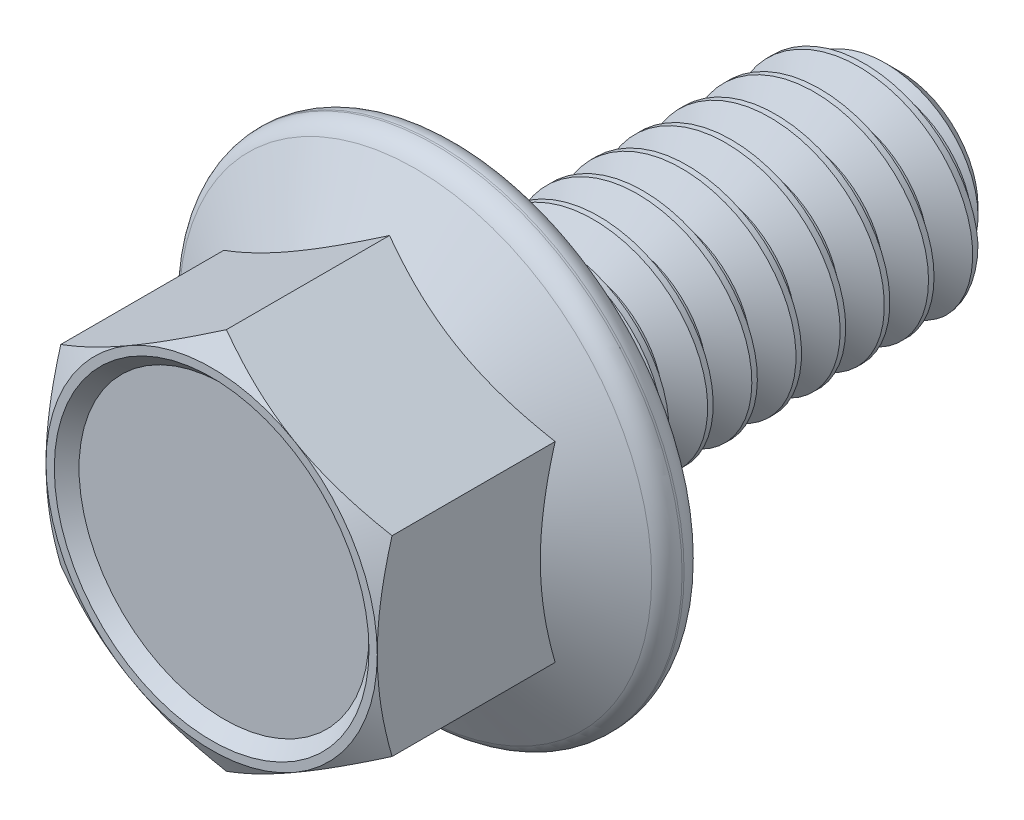
from build123d import *

# Parameters (mm, degrees)
BOSS_EXTRUDE1_REACH = 24.219
SKETCH4_OUTSIDE_W   = 102.304
SKETCH4_OUTSIDE_H   = 102.304
SKETCH4_OUTSIDE_R   = 4.7625
CUT_EXTRUDE1_DEPTH  = 23.218830572
CUT_EXTRUDE1_DRAFT  = -60
SKETCH10_R          = 4.524375
CUT_EXTRUDE2_DEPTH  = 0.3556
CUT_EXTRUDE2_DRAFT  = -45
FILLET1_R           = 0.64008
CUT_SWEEP1_PITCH    = 1.27
CUT_SWEEP1_TO       = 12.7
SKETCH8_R           = 3.175
BOSS_EXTRUDE2_DEPTH = 4.445
BOSS_EXTRUDE2_TAPER = 20


with BuildPart() as part:
    # Sketch2 → Revolve1 (revolve)
    with BuildSketch(Plane(origin=(0, 0, 0), x_dir=(0, 0, -1), z_dir=(1, 0, 0)), mode=Mode.PRIVATE) as revolve1_sk:
        Polygon((-9.906, 0), (9.906, 0), (9.906, 2.2225), (8.9535, 3.175), (-2.794, 3.175), (-2.794, 7.112), (-3.8608, 7.112), (-5.217284457, 4.7625), (-9.906, 4.7625), align=None)
    revolve(revolve1_sk.sketch.rotate(Axis((0, 0, 9.906), (0, 0, -1)), 90), axis=Axis((0, 0, 9.906), (0, 0, -1)))

    # Boss-Extrude1: up to this cone (the profile starts outside it)
    boss_extrude1_end = Plane(origin=(0, 0, 9.906), z_dir=(0, 0, -1)).offset(1.939085886) * Cone(1.732e-06, 39.45597037, 22.779914114, align=(Align.CENTER, Align.CENTER, Align.MIN), mode=Mode.PRIVATE)
    # Sketch3 → Boss-Extrude1 (add, up to the surface)
    with BuildSketch(Plane.XY.offset(9.906), mode=Mode.PRIVATE) as boss_extrude1_sk1:
        Polygon((0, 5.499261314), (-4.7625, 2.749630657), (-4.7625, -2.749630657), (0, -5.499261314), (4.7625, -2.749630657), (4.7625, 2.749630657), align=None)
    boss_extrude1_tool1 = extrude(boss_extrude1_sk1.sketch, amount=-BOSS_EXTRUDE1_REACH, mode=Mode.PRIVATE) - boss_extrude1_end
    add(boss_extrude1_tool1.solids().sort_by_distance((0, 0, 9.906))[0])


with BuildPart() as cut_extrude1_tool:
    # Sketch4 outside → Cut-Extrude1 (with draft: the straight prism first)
    with BuildSketch(Plane.XY.offset(9.906)):
        Rectangle(SKETCH4_OUTSIDE_W, SKETCH4_OUTSIDE_H)
        Circle(SKETCH4_OUTSIDE_R, mode=Mode.SUBTRACT)
    extrude(amount=-CUT_EXTRUDE1_DEPTH)
    # Cut-Extrude1: the draft: its side faces are tilted about the plane it starts from
    cut_extrude1_sides = [cut_extrude1_tool.faces().sort_by_distance(p)[0] for p in [
        (0, -51.152, -1.703415286),
        (51.152, 0, -1.703415286),
        (0, 51.152, -1.703415286),
        (-51.152, 0, -1.703415286),
        (-4.7625, 0, -1.703415286),
    ]]
    draft(cut_extrude1_sides, Plane.XY.offset(9.906), CUT_EXTRUDE1_DRAFT)


with BuildPart() as part_1:
    add(part.part)

    # Cut-Extrude1: cut by cut_extrude1_tool
    add(cut_extrude1_tool.part, mode=Mode.SUBTRACT)


with BuildPart() as cut_extrude2_tool:
    # Sketch10 → Cut-Extrude2 (with draft: the straight prism first)
    with BuildSketch(Plane.XY.offset(9.906)):
        Circle(SKETCH10_R)
    extrude(amount=-CUT_EXTRUDE2_DEPTH)
    # Cut-Extrude2: the draft: its side faces are tilted about the plane it starts from
    cut_extrude2_sides = [cut_extrude2_tool.faces().sort_by_distance(p)[0] for p in [
        (-4.524375, 0, 9.7282),
    ]]
    draft(cut_extrude2_sides, Plane.XY.offset(9.906), CUT_EXTRUDE2_DRAFT)


with BuildPart() as part_2:
    add(part_1.part)

    # Cut-Extrude2: cut by cut_extrude2_tool
    add(cut_extrude2_tool.part, mode=Mode.SUBTRACT)

    # Fillet1
    fillet1_edges = [part_2.edges().sort_by_distance(p)[0] for p in [
        (-7.112, 0, 3.8608),
        (-7.112, 0, 2.794),
    ]]
    fillet(fillet1_edges, radius=FILLET1_R)


with BuildPart() as body_2:
    # Split1: read off the stored shape, not the designer's step
    # Split1: the piece on the far side of the plane
    add(part_2.part)
    split(bisect_by=Plane.XY.offset(2.794), keep=Keep.BOTTOM)

    # Cut-Sweep1: arcs per turn and ends read off the stored shape
    # Cut-Sweep1: the profile of Sketch7 screwed along a right-hand helix through 13 turns, 8 arcs to a turn; built about Z, then put on its axis
    cut_sweep1_z = Axis((0, 0, 0), (0, 0, 1))
    cut_sweep1_corners = [(3.243740766, 0, 0.0396875), (2.350110803, 0, -0.47625), (2.350110803, 0, -0.635), (3.243740766, 0, -1.1509375)]
    with BuildLine(mode=Mode.PRIVATE) as cut_sweep1_profile:
        Line(cut_sweep1_corners[0], cut_sweep1_corners[1])
        Line(cut_sweep1_corners[1], cut_sweep1_corners[2])
        Line(cut_sweep1_corners[2], cut_sweep1_corners[3])
        Line(cut_sweep1_corners[3], cut_sweep1_corners[0])
    cut_sweep1_cap = Face(cut_sweep1_profile.wire())
    cut_sweep1_turn_angles = [0, 22.5, 45, 67.5, 90, 112.5, 135, 157.5, 180, 202.5, 225, 247.5, 270, 292.5, 315, 337.5, 360]
    cut_sweep1_turn_weights = [1, 0.9238795325112867, 1, 0.9238795325112867, 1, 0.9238795325112867, 1, 0.9238795325112867, 1, 0.9238795325112867, 1, 0.9238795325112867, 1, 0.9238795325112867, 1, 0.9238795325112867, 1]
    cut_sweep1_turn_rails = [Edge.make_bspline([Vector(p[0], p[1], 0).rotate(cut_sweep1_z, cut_sweep1_turn_angles[k]) / cut_sweep1_turn_weights[k] + Vector(0, 0, p[2] + CUT_SWEEP1_PITCH * cut_sweep1_turn_angles[k] / 360) for k in range(17)], [0, 0, 0, 1, 1, 2, 2, 3, 3, 4, 4, 5, 5, 6, 6, 7, 7, 8, 8, 8], 2, cut_sweep1_turn_weights) for p in cut_sweep1_corners]
    cut_sweep1_turn_sides = [Face.make_surface_from_curves(cut_sweep1_turn_rails[p[0]], cut_sweep1_turn_rails[p[1]]) for p in [(0, 1), (1, 2), (2, 3), (3, 0)]]
    cut_sweep1 = Plane(origin=(0, 0, -9.906), x_dir=(0, 1, 0), z_dir=(0, 0, 1)) * split(Solid(Shell([*[p.moved(Location((0, 0, CUT_SWEEP1_PITCH * i))) for i in range(13) for p in cut_sweep1_turn_sides], cut_sweep1_cap, cut_sweep1_cap.rotate(cut_sweep1_z, 4680).moved(Location((0, 0, CUT_SWEEP1_PITCH * 4680 / 360)))])), bisect_by=Plane.XY.offset(CUT_SWEEP1_TO), keep=Keep.BOTTOM, mode=Mode.PRIVATE)
    add(cut_sweep1, mode=Mode.SUBTRACT)


with BuildPart() as part_3:
    add(part_2.part)

    # Split1
    split(bisect_by=Plane.XY.offset(2.794), keep=Keep.TOP)


with BuildPart() as body_2_1:
    add(body_2.part)

    # Combine1: union part
    add(part_3.part)

    # Sketch8 → Boss-Extrude2 (add)
    with BuildSketch(Plane(origin=(0, 0, 2.794), x_dir=(-1, 0, 0), z_dir=(0, 0, -1))):
        Circle(SKETCH8_R)
    extrude(amount=BOSS_EXTRUDE2_DEPTH, taper=BOSS_EXTRUDE2_TAPER)


solid = body_2_1.part
